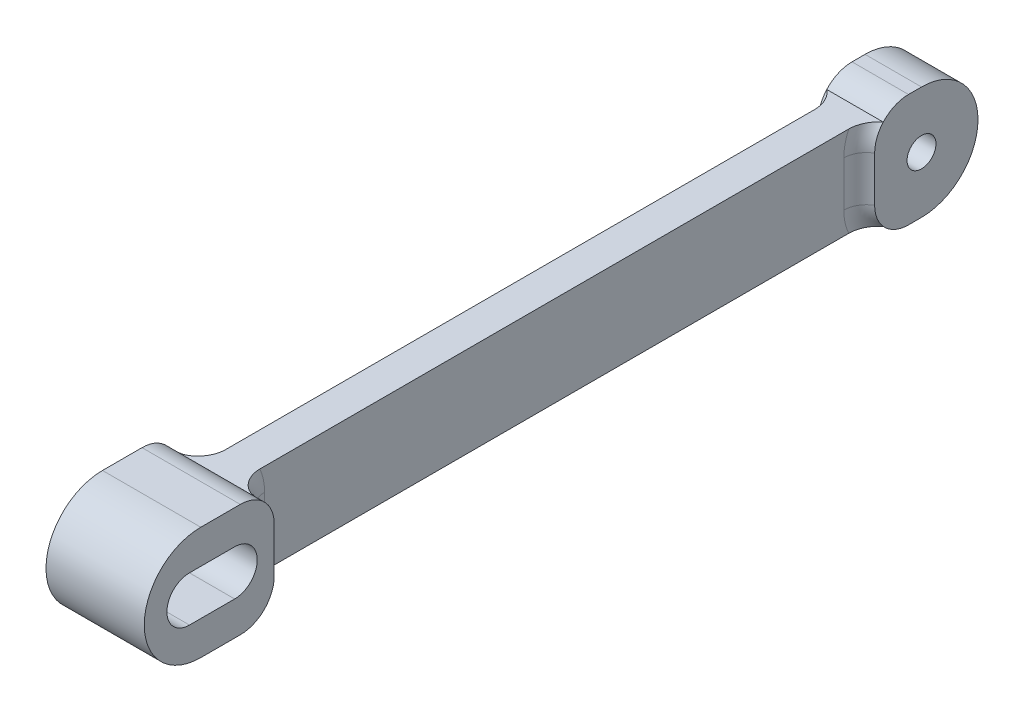
from build123d import *

# Parameters (mm, degrees)
SKETCH1_R           = 2.000000000000003
SKETCH1_R_2         = 1.2800000000000016
BOSS_EXTRUDE1_DEPTH = 2.5
BOSS_EXTRUDE2_START = -2.5
BOSS_EXTRUDE2_DEPTH = 4.35
CUT_EXTRUDE1_DEPTH  = 8.7
SKETCH5_OUTSIDE_W   = 26.059999999999995
SKETCH5_OUTSIDE_H   = 27.360000000000003
CUT_EXTRUDE2_DEPTH  = 55
FILLET1_R           = 3
FILLET2_R           = 2
BOSS_EXTRUDE3_DEPTH = 1


with BuildPart() as part:
    # Sketch1 → Boss-Extrude1 (new, symmetric)
    with BuildSketch(Plane(origin=(0, 0, 0), x_dir=(0, 0, -1), z_dir=(1, 0, 0))):
        with BuildLine():
            Line((-32.325, 5.000000000000013), (32.325, 5.000000000000025))
            ThreePointArc((32.325, 5.000000000000025), (37.32499999999999, 0), (32.325, -4.999999999999987))
            Line((32.325, -4.999999999999987), (-32.325, -4.999999999999987))
            ThreePointArc((-32.325, -4.999999999999987), (-37.32500000000002, 6.1e-16), (-32.325, 5.000000000000013))
        make_face()
        with Locations((-32.325, 0)):
            Circle(SKETCH1_R, mode=Mode.SUBTRACT)
        with Locations((32.325, 0)):
            Circle(SKETCH1_R_2, mode=Mode.SUBTRACT)
    extrude(amount=BOSS_EXTRUDE1_DEPTH, both=True)

    # Sketch3 → Boss-Extrude2 (add, symmetric)
    # profile 1 of 2: a face of its own
    with BuildSketch(Plane(origin=(2.5, 0, 0), x_dir=(0, 0, -1), z_dir=(1, 0, 0)).offset(BOSS_EXTRUDE2_START)):
        with BuildLine():
            Line((-26.825000000000003, -4.999999999999987), (-26.825000000000003, 5.000000000000024))
            Line((-26.825000000000003, 5.000000000000024), (-32.325, 5.000000000000025))
            ThreePointArc((-32.325, 5.000000000000013), (-37.32500000000002, 1.341e-14), (-32.325, -4.999999999999987))
            Line((-32.325, -4.9999999999999885), (-26.825000000000003, -4.999999999999987))
        make_face()
        with BuildLine():
            ThreePointArc((-34.325, -2.000000000000003), (-36.325, -1.32e-15), (-34.325, 2.0000000000000004))
            Line((-34.325, 2.0000000000000013), (-30.325, 2.0000000000000027))
            ThreePointArc((-30.325, 2.0000000000000018), (-28.324999999999992, -3.2e-16), (-30.325, -2.0000000000000027))
            Line((-30.325, -2.0000000000000036), (-34.325, -2.000000000000004))
        make_face(mode=Mode.SUBTRACT)
    # profile 2 of 2: a face of its own
    with BuildSketch(Plane(origin=(2.5, 0, 0), x_dir=(0, 0, -1), z_dir=(1, 0, 0)).offset(BOSS_EXTRUDE2_START)):
        with BuildLine():
            ThreePointArc((-32.325, -4.999999999999987), (-37.32500000000002, 1.341e-14), (-32.325, 5.000000000000013))
            Line((-32.325, 5.000000000000025), (-33.325, 5.000000000000025))
            ThreePointArc((-33.325, 5.000000000000025), (-38.32500000000001, 1.829e-14), (-33.325, -4.999999999999989))
            Line((-33.325, -4.9999999999999885), (-32.325, -4.9999999999999885))
        make_face()
    extrude(amount=BOSS_EXTRUDE2_DEPTH, both=True)

    # Sketch4 → Cut-Extrude1 (cut)
    with BuildSketch(Plane(origin=(4.35, 0, 0), x_dir=(0, 0, -1), z_dir=(1, 0, 0))):
        with BuildLine():
            Line((-30.32500000000482, 2.000000000000003), (-34.32500000000001, 2.0000000000000013))
            ThreePointArc((-34.32500000000001, 2.0000000000000013), (-36.324999999999996, 1.195448e-11), (-34.32500000002392, -2.000000000000004))
            Line((-34.32500000002392, -2.000000000000004), (-30.32500000000482, -2.000000000000003))
            ThreePointArc((-30.32500000000482, -2.000000000000003), (-28.325000000004817, 0), (-30.32500000000482, 2.000000000000003))
        make_face()
    extrude(amount=-CUT_EXTRUDE1_DEPTH, mode=Mode.SUBTRACT)

    # Sketch5 outside → Cut-Extrude2 (cut)
    with BuildSketch(Plane(origin=(0, 0, 26.824999999973898), x_dir=(-1, 0, 0), z_dir=(0, 0, -1))):
        Rectangle(SKETCH5_OUTSIDE_W, SKETCH5_OUTSIDE_H)
        Polygon((1.5, 4.000000000000025), (-1.5, 4.000000000000025), (-1.4999999999999991, -4.000000000000006), (1.500000000000001, -4.000000000000006), align=None, mode=Mode.SUBTRACT)
    extrude(amount=CUT_EXTRUDE2_DEPTH, mode=Mode.SUBTRACT)

    # Fillet1
    # the kernel refuses this fillet: 3 mm, written as the material it takes off along each edge
    with BuildSketch(Plane(origin=(2.5, -4.999999999999987, 26.825000000000003), x_dir=(0, 1.0, -8.701780037275361e-12), z_dir=(-1, 0, 0))) as fillet1_piece_1_section:
        with BuildLine():
            CenterArc((FILLET1_R, -FILLET1_R), FILLET1_R, 89.99999999950143, 90.00000000000003)
            Line((-2.610534e-11, -FILLET1_R), (0, 0))
            Line((0, 0), (FILLET1_R, 0))
        make_face()
    fillet1_piece_1 = extrude(amount=14.349999999999998, mode=Mode.PRIVATE)
    fillet1_piece_1 = split(fillet1_piece_1, bisect_by=Plane(origin=(1.499999999999999, -4.999999999999987, 26.825000000000003), z_dir=(1, -1.1e-16, 0)), keep=Keep.TOP, mode=Mode.PRIVATE)
    fillet1_piece_1 = split(fillet1_piece_1, bisect_by=Plane(origin=(2.5, -4.000000000000006, 26.825000000000003), z_dir=(0, 1, 0)), keep=Keep.TOP, mode=Mode.PRIVATE)
    add(fillet1_piece_1, mode=Mode.SUBTRACT)
    with BuildSketch(Plane(origin=(2.5, -4.999999999999987, 26.825000000000003), x_dir=(0, 1.0, -8.701780037275361e-12), z_dir=(-1, 0, 0))) as fillet1_piece_2_section:
        with BuildLine():
            CenterArc((FILLET1_R, -FILLET1_R), FILLET1_R, 89.99999999950143, 90.00000000000003)
            Line((-2.610534e-11, -FILLET1_R), (0, 0))
            Line((0, 0), (FILLET1_R, 0))
        make_face()
    fillet1_piece_2 = extrude(amount=14.349999999999998, mode=Mode.PRIVATE)
    fillet1_piece_2 = split(fillet1_piece_2, bisect_by=Plane(origin=(1.4999999999999991, -4.999999999999987, 26.825000000000003), z_dir=(1, -1.1e-16, 0)), keep=Keep.TOP, mode=Mode.PRIVATE)
    fillet1_piece_2 = split(fillet1_piece_2, bisect_by=Plane(origin=(2.5, -4.000000000000006, 26.825000000000003), z_dir=(0, -1, 0)), keep=Keep.TOP, mode=Mode.PRIVATE)
    add(fillet1_piece_2, mode=Mode.SUBTRACT)
    with BuildSketch(Plane(origin=(2.5, -4.999999999999987, 26.825000000000003), x_dir=(0, 1.0, -8.701780037275361e-12), z_dir=(-1, 0, 0))) as fillet1_piece_3_section:
        with BuildLine():
            CenterArc((FILLET1_R, -FILLET1_R), FILLET1_R, 89.99999999950143, 90.00000000000003)
            Line((-2.610534e-11, -FILLET1_R), (0, 0))
            Line((0, 0), (FILLET1_R, 0))
        make_face()
    fillet1_piece_3 = extrude(amount=14.349999999999998, mode=Mode.PRIVATE)
    fillet1_piece_3 = split(fillet1_piece_3, bisect_by=Plane(origin=(1.4999999999999991, -4.999999999999987, 26.825000000000003), z_dir=(-1, 1.1e-16, 0)), keep=Keep.TOP, mode=Mode.PRIVATE)
    fillet1_piece_3 = split(fillet1_piece_3, bisect_by=Plane(origin=(-1.5000000000000009, -4.999999999999986, 26.825000000000003), z_dir=(1, -1.4e-16, 0)), keep=Keep.TOP, mode=Mode.PRIVATE)
    fillet1_piece_3 = split(fillet1_piece_3, bisect_by=Plane(origin=(2.5, -4.000000000000006, 26.825000000000003), z_dir=(0, -1, 0)), keep=Keep.TOP, mode=Mode.PRIVATE)
    add(fillet1_piece_3, mode=Mode.SUBTRACT)
    with BuildSketch(Plane(origin=(2.5, -4.999999999999987, 26.825000000000003), x_dir=(0, 1.0, -8.701780037275361e-12), z_dir=(-1, 0, 0))) as fillet1_piece_4_section:
        with BuildLine():
            CenterArc((FILLET1_R, -FILLET1_R), FILLET1_R, 89.99999999950143, 90.00000000000003)
            Line((-2.610534e-11, -FILLET1_R), (0, 0))
            Line((0, 0), (FILLET1_R, 0))
        make_face()
    fillet1_piece_4 = extrude(amount=14.349999999999998, mode=Mode.PRIVATE)
    fillet1_piece_4 = split(fillet1_piece_4, bisect_by=Plane(origin=(-1.5000000000000009, -4.999999999999986, 26.825000000000003), z_dir=(-1, 1.4e-16, 0)), keep=Keep.TOP, mode=Mode.PRIVATE)
    fillet1_piece_4 = split(fillet1_piece_4, bisect_by=Plane(origin=(2.5, -4.000000000000006, 26.825000000000003), z_dir=(0, 1, 0)), keep=Keep.TOP, mode=Mode.PRIVATE)
    add(fillet1_piece_4, mode=Mode.SUBTRACT)
    with BuildSketch(Plane(origin=(2.5, -4.999999999999987, 26.825000000000003), x_dir=(0, 1.0, -8.701780037275361e-12), z_dir=(-1, 0, 0))) as fillet1_piece_5_section:
        with BuildLine():
            CenterArc((FILLET1_R, -FILLET1_R), FILLET1_R, 89.99999999950143, 90.00000000000003)
            Line((-2.610534e-11, -FILLET1_R), (0, 0))
            Line((0, 0), (FILLET1_R, 0))
        make_face()
    fillet1_piece_5 = extrude(amount=14.349999999999998, mode=Mode.PRIVATE)
    fillet1_piece_5 = split(fillet1_piece_5, bisect_by=Plane(origin=(-1.5000000000000009, -4.999999999999986, 26.825000000000003), z_dir=(-1, 1.4e-16, 0)), keep=Keep.TOP, mode=Mode.PRIVATE)
    fillet1_piece_5 = split(fillet1_piece_5, bisect_by=Plane(origin=(2.5, -4.000000000000006, 26.825000000000003), z_dir=(0, -1, 0)), keep=Keep.TOP, mode=Mode.PRIVATE)
    add(fillet1_piece_5, mode=Mode.SUBTRACT)
    with BuildSketch(Plane(origin=(-2.5, 5.000000000000014, 26.824999999973898), x_dir=(0, -1, 0), z_dir=(1, 0, 0))) as fillet1_piece_6_section:
        with BuildLine():
            CenterArc((FILLET1_R, -FILLET1_R), FILLET1_R, 90, 90)
            Line((8.9e-16, -FILLET1_R), (0, 0))
            Line((0, 0), (FILLET1_R, 0))
        make_face()
    fillet1_piece_6 = extrude(amount=5, mode=Mode.PRIVATE)
    fillet1_piece_6 = split(fillet1_piece_6, bisect_by=Plane(origin=(-1.4999999999999998, 5.000000000000014, 26.824999999973898), z_dir=(-1, 1.4e-16, 0)), keep=Keep.TOP, mode=Mode.PRIVATE)
    fillet1_piece_6 = split(fillet1_piece_6, bisect_by=Plane(origin=(-2.5, 4.000000000000025, 26.824999999973898), z_dir=(0, -1, 0)), keep=Keep.TOP, mode=Mode.PRIVATE)
    add(fillet1_piece_6, mode=Mode.SUBTRACT)
    with BuildSketch(Plane(origin=(-2.5, 5.000000000000014, 26.824999999973898), x_dir=(0, -1, 0), z_dir=(1, 0, 0))) as fillet1_piece_7_section:
        with BuildLine():
            CenterArc((FILLET1_R, -FILLET1_R), FILLET1_R, 90, 90)
            Line((8.9e-16, -FILLET1_R), (0, 0))
            Line((0, 0), (FILLET1_R, 0))
        make_face()
    fillet1_piece_7 = extrude(amount=5, mode=Mode.PRIVATE)
    fillet1_piece_7 = split(fillet1_piece_7, bisect_by=Plane(origin=(-1.5, 5.000000000000014, 26.824999999973898), z_dir=(-1, 1.4e-16, 0)), keep=Keep.TOP, mode=Mode.PRIVATE)
    fillet1_piece_7 = split(fillet1_piece_7, bisect_by=Plane(origin=(-2.5, 4.000000000000025, 26.824999999973898), z_dir=(0, 1, 0)), keep=Keep.TOP, mode=Mode.PRIVATE)
    add(fillet1_piece_7, mode=Mode.SUBTRACT)
    with BuildSketch(Plane(origin=(-2.5, 5.000000000000014, 26.824999999973898), x_dir=(0, -1, 0), z_dir=(1, 0, 0))) as fillet1_piece_8_section:
        with BuildLine():
            CenterArc((FILLET1_R, -FILLET1_R), FILLET1_R, 90, 90)
            Line((8.9e-16, -FILLET1_R), (0, 0))
            Line((0, 0), (FILLET1_R, 0))
        make_face()
    fillet1_piece_8 = extrude(amount=5, mode=Mode.PRIVATE)
    fillet1_piece_8 = split(fillet1_piece_8, bisect_by=Plane(origin=(1.5, 5.000000000000014, 26.824999999973898), z_dir=(-1, 1.1e-16, 0)), keep=Keep.TOP, mode=Mode.PRIVATE)
    fillet1_piece_8 = split(fillet1_piece_8, bisect_by=Plane(origin=(-1.5, 5.000000000000014, 26.824999999973898), z_dir=(1, -1.4e-16, 0)), keep=Keep.TOP, mode=Mode.PRIVATE)
    fillet1_piece_8 = split(fillet1_piece_8, bisect_by=Plane(origin=(-2.5, 4.000000000000025, 26.824999999973898), z_dir=(0, 1, 0)), keep=Keep.TOP, mode=Mode.PRIVATE)
    add(fillet1_piece_8, mode=Mode.SUBTRACT)
    with BuildSketch(Plane(origin=(-2.5, 5.000000000000014, 26.824999999973898), x_dir=(0, -1, 0), z_dir=(1, 0, 0))) as fillet1_piece_9_section:
        with BuildLine():
            CenterArc((FILLET1_R, -FILLET1_R), FILLET1_R, 90, 90)
            Line((8.9e-16, -FILLET1_R), (0, 0))
            Line((0, 0), (FILLET1_R, 0))
        make_face()
    fillet1_piece_9 = extrude(amount=5, mode=Mode.PRIVATE)
    fillet1_piece_9 = split(fillet1_piece_9, bisect_by=Plane(origin=(1.5, 5.000000000000014, 26.824999999973898), z_dir=(1, -1.1e-16, 0)), keep=Keep.TOP, mode=Mode.PRIVATE)
    fillet1_piece_9 = split(fillet1_piece_9, bisect_by=Plane(origin=(-2.5, 4.000000000000025, 26.824999999973898), z_dir=(0, -1, 0)), keep=Keep.TOP, mode=Mode.PRIVATE)
    add(fillet1_piece_9, mode=Mode.SUBTRACT)
    with BuildSketch(Plane(origin=(-2.5, 5.000000000000014, 26.824999999973898), x_dir=(0, -1, 0), z_dir=(1, 0, 0))) as fillet1_piece_10_section:
        with BuildLine():
            CenterArc((FILLET1_R, -FILLET1_R), FILLET1_R, 90, 90)
            Line((8.9e-16, -FILLET1_R), (0, 0))
            Line((0, 0), (FILLET1_R, 0))
        make_face()
    fillet1_piece_10 = extrude(amount=5, mode=Mode.PRIVATE)
    fillet1_piece_10 = split(fillet1_piece_10, bisect_by=Plane(origin=(1.5, 5.000000000000014, 26.824999999973898), z_dir=(1, -1.1e-16, 0)), keep=Keep.TOP, mode=Mode.PRIVATE)
    fillet1_piece_10 = split(fillet1_piece_10, bisect_by=Plane(origin=(-2.5, 4.000000000000025, 26.824999999973898), z_dir=(0, 1, 0)), keep=Keep.TOP, mode=Mode.PRIVATE)
    add(fillet1_piece_10, mode=Mode.SUBTRACT)
    with BuildSketch(Plane(origin=(10, -4.999999999999987, -28.175000000026102), x_dir=(0, 0, -1), z_dir=(-1, 0, 0))) as fillet1_piece_11_section:
        with BuildLine():
            CenterArc((FILLET1_R, -FILLET1_R), FILLET1_R, 90, 90)
            Line((0, -FILLET1_R), (0, 0))
            Line((0, 0), (FILLET1_R, 0))
        make_face()
    fillet1_piece_11 = extrude(amount=20, mode=Mode.PRIVATE)
    fillet1_piece_11 = split(fillet1_piece_11, bisect_by=Plane(origin=(10, -4.000000000000006, -28.175000000026102), z_dir=(0, -1, 0)), keep=Keep.TOP, mode=Mode.PRIVATE)
    fillet1_piece_11 = split(fillet1_piece_11, bisect_by=Plane(origin=(1.5, -4.999999999999986, -28.175000000026102), z_dir=(1, -1.1e-16, 0)), keep=Keep.TOP, mode=Mode.PRIVATE)
    add(fillet1_piece_11, mode=Mode.SUBTRACT)
    with BuildSketch(Plane(origin=(10, -4.999999999999987, -28.175000000026102), x_dir=(0, 0, -1), z_dir=(-1, 0, 0))) as fillet1_piece_12_section:
        with BuildLine():
            CenterArc((FILLET1_R, -FILLET1_R), FILLET1_R, 90, 90)
            Line((0, -FILLET1_R), (0, 0))
            Line((0, 0), (FILLET1_R, 0))
        make_face()
    fillet1_piece_12 = extrude(amount=20, mode=Mode.PRIVATE)
    fillet1_piece_12 = split(fillet1_piece_12, bisect_by=Plane(origin=(10, -4.000000000000006, -28.175000000026102), z_dir=(0, 1, 0)), keep=Keep.TOP, mode=Mode.PRIVATE)
    fillet1_piece_12 = split(fillet1_piece_12, bisect_by=Plane(origin=(1.5, -4.999999999999986, -28.175000000026102), z_dir=(1, -1.1e-16, 0)), keep=Keep.TOP, mode=Mode.PRIVATE)
    add(fillet1_piece_12, mode=Mode.SUBTRACT)
    with BuildSketch(Plane(origin=(10, -4.999999999999987, -28.175000000026102), x_dir=(0, 0, -1), z_dir=(-1, 0, 0))) as fillet1_piece_13_section:
        with BuildLine():
            CenterArc((FILLET1_R, -FILLET1_R), FILLET1_R, 90, 90)
            Line((0, -FILLET1_R), (0, 0))
            Line((0, 0), (FILLET1_R, 0))
        make_face()
    fillet1_piece_13 = extrude(amount=20, mode=Mode.PRIVATE)
    fillet1_piece_13 = split(fillet1_piece_13, bisect_by=Plane(origin=(-1.5000000000000018, -4.999999999999985, -28.175000000026102), z_dir=(1, -1.4e-16, 0)), keep=Keep.TOP, mode=Mode.PRIVATE)
    fillet1_piece_13 = split(fillet1_piece_13, bisect_by=Plane(origin=(10, -4.000000000000006, -28.175000000026102), z_dir=(0, -1, 0)), keep=Keep.TOP, mode=Mode.PRIVATE)
    fillet1_piece_13 = split(fillet1_piece_13, bisect_by=Plane(origin=(1.5, -4.999999999999986, -28.175000000026102), z_dir=(-1, 1.1e-16, 0)), keep=Keep.TOP, mode=Mode.PRIVATE)
    add(fillet1_piece_13, mode=Mode.SUBTRACT)
    with BuildSketch(Plane(origin=(10, -4.999999999999987, -28.175000000026102), x_dir=(0, 0, -1), z_dir=(-1, 0, 0))) as fillet1_piece_14_section:
        with BuildLine():
            CenterArc((FILLET1_R, -FILLET1_R), FILLET1_R, 90, 90)
            Line((0, -FILLET1_R), (0, 0))
            Line((0, 0), (FILLET1_R, 0))
        make_face()
    fillet1_piece_14 = extrude(amount=20, mode=Mode.PRIVATE)
    fillet1_piece_14 = split(fillet1_piece_14, bisect_by=Plane(origin=(-1.5000000000000018, -4.999999999999985, -28.175000000026102), z_dir=(-1, 1.4e-16, 0)), keep=Keep.TOP, mode=Mode.PRIVATE)
    fillet1_piece_14 = split(fillet1_piece_14, bisect_by=Plane(origin=(10, -4.000000000000006, -28.175000000026102), z_dir=(0, -1, 0)), keep=Keep.TOP, mode=Mode.PRIVATE)
    add(fillet1_piece_14, mode=Mode.SUBTRACT)
    with BuildSketch(Plane(origin=(10, -4.999999999999987, -28.175000000026102), x_dir=(0, 0, -1), z_dir=(-1, 0, 0))) as fillet1_piece_15_section:
        with BuildLine():
            CenterArc((FILLET1_R, -FILLET1_R), FILLET1_R, 90, 90)
            Line((0, -FILLET1_R), (0, 0))
            Line((0, 0), (FILLET1_R, 0))
        make_face()
    fillet1_piece_15 = extrude(amount=20, mode=Mode.PRIVATE)
    fillet1_piece_15 = split(fillet1_piece_15, bisect_by=Plane(origin=(-1.5000000000000018, -4.999999999999985, -28.175000000026102), z_dir=(-1, 1.4e-16, 0)), keep=Keep.TOP, mode=Mode.PRIVATE)
    fillet1_piece_15 = split(fillet1_piece_15, bisect_by=Plane(origin=(10, -4.000000000000006, -28.175000000026102), z_dir=(0, 1, 0)), keep=Keep.TOP, mode=Mode.PRIVATE)
    add(fillet1_piece_15, mode=Mode.SUBTRACT)
    with BuildSketch(Plane(origin=(-10, 5.000000000000024, -28.175000000026102), x_dir=(0, 3e-16, -1), z_dir=(1, 0, 0))) as fillet1_piece_16_section:
        with BuildLine():
            CenterArc((FILLET1_R, -FILLET1_R), FILLET1_R, 89.99999999999999, 90.00000000000001)
            Line((-8.9e-16, -FILLET1_R), (0, 0))
            Line((0, 0), (FILLET1_R, 0))
        make_face()
    fillet1_piece_16 = extrude(amount=20, mode=Mode.PRIVATE)
    fillet1_piece_16 = split(fillet1_piece_16, bisect_by=Plane(origin=(-1.5, 5.000000000000023, -28.175000000026102), z_dir=(-1, 1.4e-16, 0)), keep=Keep.TOP, mode=Mode.PRIVATE)
    fillet1_piece_16 = split(fillet1_piece_16, bisect_by=Plane(origin=(-10, 4.000000000000025, -28.175000000026102), z_dir=(0, 1, 0)), keep=Keep.TOP, mode=Mode.PRIVATE)
    add(fillet1_piece_16, mode=Mode.SUBTRACT)
    with BuildSketch(Plane(origin=(-10, 5.000000000000024, -28.175000000026102), x_dir=(0, 3e-16, -1), z_dir=(1, 0, 0))) as fillet1_piece_17_section:
        with BuildLine():
            CenterArc((FILLET1_R, -FILLET1_R), FILLET1_R, 89.99999999999999, 90.00000000000001)
            Line((-8.9e-16, -FILLET1_R), (0, 0))
            Line((0, 0), (FILLET1_R, 0))
        make_face()
    fillet1_piece_17 = extrude(amount=20, mode=Mode.PRIVATE)
    fillet1_piece_17 = split(fillet1_piece_17, bisect_by=Plane(origin=(-1.5, 5.000000000000023, -28.175000000026102), z_dir=(-1, 1.4e-16, 0)), keep=Keep.TOP, mode=Mode.PRIVATE)
    fillet1_piece_17 = split(fillet1_piece_17, bisect_by=Plane(origin=(-10, 4.000000000000025, -28.175000000026102), z_dir=(0, -1, 0)), keep=Keep.TOP, mode=Mode.PRIVATE)
    add(fillet1_piece_17, mode=Mode.SUBTRACT)
    with BuildSketch(Plane(origin=(-10, 5.000000000000024, -28.175000000026102), x_dir=(0, 3e-16, -1), z_dir=(1, 0, 0))) as fillet1_piece_18_section:
        with BuildLine():
            CenterArc((FILLET1_R, -FILLET1_R), FILLET1_R, 89.99999999999999, 90.00000000000001)
            Line((-8.9e-16, -FILLET1_R), (0, 0))
            Line((0, 0), (FILLET1_R, 0))
        make_face()
    fillet1_piece_18 = extrude(amount=20, mode=Mode.PRIVATE)
    fillet1_piece_18 = split(fillet1_piece_18, bisect_by=Plane(origin=(-1.5, 5.000000000000023, -28.175000000026102), z_dir=(1, -1.4e-16, 0)), keep=Keep.TOP, mode=Mode.PRIVATE)
    fillet1_piece_18 = split(fillet1_piece_18, bisect_by=Plane(origin=(-10, 4.000000000000025, -28.175000000026102), z_dir=(0, 1, 0)), keep=Keep.TOP, mode=Mode.PRIVATE)
    fillet1_piece_18 = split(fillet1_piece_18, bisect_by=Plane(origin=(1.5, 5.000000000000023, -28.175000000026102), z_dir=(-1, 1.1e-16, 0)), keep=Keep.TOP, mode=Mode.PRIVATE)
    add(fillet1_piece_18, mode=Mode.SUBTRACT)
    with BuildSketch(Plane(origin=(-10, 5.000000000000024, -28.175000000026102), x_dir=(0, 3e-16, -1), z_dir=(1, 0, 0))) as fillet1_piece_19_section:
        with BuildLine():
            CenterArc((FILLET1_R, -FILLET1_R), FILLET1_R, 89.99999999999999, 90.00000000000001)
            Line((-8.9e-16, -FILLET1_R), (0, 0))
            Line((0, 0), (FILLET1_R, 0))
        make_face()
    fillet1_piece_19 = extrude(amount=20, mode=Mode.PRIVATE)
    fillet1_piece_19 = split(fillet1_piece_19, bisect_by=Plane(origin=(-10, 4.000000000000025, -28.175000000026102), z_dir=(0, 1, 0)), keep=Keep.TOP, mode=Mode.PRIVATE)
    fillet1_piece_19 = split(fillet1_piece_19, bisect_by=Plane(origin=(1.5, 5.000000000000023, -28.175000000026102), z_dir=(1, -1.1e-16, 0)), keep=Keep.TOP, mode=Mode.PRIVATE)
    add(fillet1_piece_19, mode=Mode.SUBTRACT)
    with BuildSketch(Plane(origin=(-10, 5.000000000000024, -28.175000000026102), x_dir=(0, 3e-16, -1), z_dir=(1, 0, 0))) as fillet1_piece_20_section:
        with BuildLine():
            CenterArc((FILLET1_R, -FILLET1_R), FILLET1_R, 89.99999999999999, 90.00000000000001)
            Line((-8.9e-16, -FILLET1_R), (0, 0))
            Line((0, 0), (FILLET1_R, 0))
        make_face()
    fillet1_piece_20 = extrude(amount=20, mode=Mode.PRIVATE)
    fillet1_piece_20 = split(fillet1_piece_20, bisect_by=Plane(origin=(-10, 4.000000000000025, -28.175000000026102), z_dir=(0, -1, 0)), keep=Keep.TOP, mode=Mode.PRIVATE)
    fillet1_piece_20 = split(fillet1_piece_20, bisect_by=Plane(origin=(1.5, 5.000000000000023, -28.175000000026102), z_dir=(1, -1.1e-16, 0)), keep=Keep.TOP, mode=Mode.PRIVATE)
    add(fillet1_piece_20, mode=Mode.SUBTRACT)
    with BuildSketch(Plane(origin=(-2.5, 5.000000000000024, 26.825000000000003), x_dir=(0, -1.0, -8.701780037275332e-12), z_dir=(-1, 0, 0))) as fillet1_piece_21:
        with BuildLine():
            CenterArc((FILLET1_R, FILLET1_R), FILLET1_R, 180.00000000049855, 90)
            Line((-2.609557e-11, FILLET1_R), (0, 0))
            Line((0, 0), (FILLET1_R, 0))
        make_face()
    extrude(amount=9.350000000000025, mode=Mode.SUBTRACT)
    with BuildSketch(Plane(origin=(11.850000000000026, 5.000000000000024, 26.825000000000003), x_dir=(0, -1.0, -8.701780037275332e-12), z_dir=(-1, 0, 0))) as fillet1_piece_22:
        with BuildLine():
            CenterArc((FILLET1_R, FILLET1_R), FILLET1_R, 180.00000000049855, 90)
            Line((-2.609557e-11, FILLET1_R), (0, 0))
            Line((0, 0), (FILLET1_R, 0))
        make_face()
    extrude(amount=9.350000000000026, mode=Mode.SUBTRACT)
    with BuildSketch(Plane(origin=(2.5, -4.999999999999987, 26.825000000000003), x_dir=(0, 1.0, -8.701780037275361e-12), z_dir=(1, 0, 0))) as fillet1_piece_23:
        with BuildLine():
            CenterArc((FILLET1_R, FILLET1_R), FILLET1_R, 180.00000000049855, 90)
            Line((-2.610534e-11, FILLET1_R), (0, 0))
            Line((0, 0), (FILLET1_R, 0))
        make_face()
    extrude(amount=9.35, mode=Mode.SUBTRACT)

    # Fillet2
    # the kernel refuses this fillet: 2 mm, written as the material it adds along each edge
    with BuildSketch(Plane(origin=(-1.5, 2, -31.175000000026), x_dir=(0, 0, 1), z_dir=(0, -1, 0))) as fillet2_piece_1_section:
        with BuildLine():
            CenterArc((4.7320508075689744, 2), FILLET2_R, 209.99999999999858, 60.00000000000142)
            Line((4.7320508075689744, 0), (3, 0))
            Line((3, 0), (3.000000000000071, 1.0000000000000417))
        make_face()
    fillet2_piece_1 = revolve(axis=Axis((-1.5, 2, -31.175000000026), (-1, 0, 0)), revolution_arc=124.5168172217792, mode=Mode.PRIVATE)
    fillet2_piece_1 = split(fillet2_piece_1, bisect_by=Plane(origin=(-1.5, 4, -31.175000000026), z_dir=(0, -1, 0)), keep=Keep.TOP, mode=Mode.PRIVATE)
    add(fillet2_piece_1)
    with BuildSketch(Plane(origin=(-1.5, -2, -31.175000000026), x_dir=(0, 1.5e-16, 1), z_dir=(0, 1, -1.5e-16))) as fillet2_piece_2_section:
        with BuildLine():
            CenterArc((4.7320508075689744, -2.000000000000001), FILLET2_R, 90, 60.00000000000142)
            Line((3.000000000000071, -1.0000000000000422), (3, 0))
            Line((3, 0), (4.7320508075689744, -8.9e-16))
        make_face()
    fillet2_piece_2 = revolve(axis=Axis((-1.5, -2, -31.175000000026), (1, 0, 0)), revolution_arc=124.51681722177923, mode=Mode.PRIVATE)
    fillet2_piece_2 = split(fillet2_piece_2, bisect_by=Plane(origin=(-1.5, -4, -31.175000000026), z_dir=(0, 1, 0)), keep=Keep.TOP, mode=Mode.PRIVATE)
    add(fillet2_piece_2)
    with BuildSketch(Plane(origin=(1.5, 2, -31.175000000026), x_dir=(0, -1.5e-16, 1), z_dir=(0, -1, -1.5e-16))) as fillet2_piece_3_section:
        with BuildLine():
            CenterArc((4.7320508075689744, -2), FILLET2_R, 90, 60.00000000000142)
            Line((4.7320508075689744, 0), (3, 0))
            Line((3, 0), (3.000000000000071, -1.0000000000000417))
        make_face()
    fillet2_piece_3 = revolve(axis=Axis((1.5, 2, -31.175000000026), (-1, 0, 0)), revolution_arc=124.51681722177923, mode=Mode.PRIVATE)
    fillet2_piece_3 = split(fillet2_piece_3, bisect_by=Plane(origin=(1.5, 4, -31.175000000026), z_dir=(0, -1, 0)), keep=Keep.TOP, mode=Mode.PRIVATE)
    add(fillet2_piece_3)
    with BuildSketch(Plane(origin=(1.5, -2, -31.175000000026), x_dir=(0, 0, 1), z_dir=(0, 1, 0))) as fillet2_piece_4_section:
        with BuildLine():
            CenterArc((4.7320508075689744, 2), FILLET2_R, 209.99999999999858, 60.00000000000142)
            Line((3.000000000000071, 1.0000000000000417), (3, 0))
            Line((3, 0), (4.7320508075689744, 0))
        make_face()
    fillet2_piece_4 = revolve(axis=Axis((1.5, -2, -31.175000000026), (1, 0, 0)), revolution_arc=124.5168172217792, mode=Mode.PRIVATE)
    fillet2_piece_4 = split(fillet2_piece_4, bisect_by=Plane(origin=(1.5, -4, -31.175000000026), z_dir=(0, 1, 0)), keep=Keep.TOP, mode=Mode.PRIVATE)
    add(fillet2_piece_4)
    with BuildSketch(Plane(origin=(1.5, 2, 29.824999999974), x_dir=(0, 0.6780114096841094, 0.7350513780261668), z_dir=(0, -0.7350513780261668, 0.6780114096841094))) as fillet2_piece_5_section:
        with BuildLine():
            CenterArc((3.0000000000000027 + FILLET2_R, -FILLET2_R), FILLET2_R, 90.00000000000007, 89.99999999999994)
            Line((3.0000000000000027 + FILLET2_R, 0), (3.0000000000000027, 0))
            Line((3.0000000000000027, 0), (3.0000000000000027, -FILLET2_R))
        make_face()
    fillet2_piece_5 = revolve(axis=Axis((1.5, 2, 29.824999999974), (-1, 0, 0)), revolution_arc=137.31155765907098, mode=Mode.PRIVATE)
    fillet2_piece_5 = split(fillet2_piece_5, bisect_by=Plane(origin=(1.5, 4, 29.824999999974), z_dir=(0, -1, 0)), keep=Keep.TOP, mode=Mode.PRIVATE)
    add(fillet2_piece_5)
    with BuildSketch(Plane(origin=(1.5, -1.9999999999729998, 29.824999999973), x_dir=(0, -4.645321164768272e-12, -1.0), z_dir=(0, 1.0, -4.645321164768272e-12))) as fillet2_piece_6_section:
        with BuildLine():
            CenterArc((3 + FILLET2_R, -FILLET2_R), FILLET2_R, 90.0000000000002, 89.99999999999977)
            Line((3 + FILLET2_R, 0), (3, 0))
            Line((3, 0), (3, -FILLET2_R))
        make_face()
    fillet2_piece_6 = revolve(axis=Axis((1.5, -1.9999999999729998, 29.824999999973), (-1, 0, 0)), revolution_arc=137.31155765949686, mode=Mode.PRIVATE)
    fillet2_piece_6 = split(fillet2_piece_6, bisect_by=Plane(origin=(1.5, -4, 29.824999999973), z_dir=(0, 1, 0)), keep=Keep.TOP, mode=Mode.PRIVATE)
    add(fillet2_piece_6)
    with BuildSketch(Plane(origin=(-1.5, -1.9999999999729998, 29.824999999973), x_dir=(0, -0.6780114096752294, 0.7350513780343578), z_dir=(0, 0.7350513780343578, 0.6780114096752294))) as fillet2_piece_7_section:
        with BuildLine():
            CenterArc((2.9999999999999987 + FILLET2_R, -FILLET2_R), FILLET2_R, 90, 89.99999999999997)
            Line((3.000000000000004, -FILLET2_R), (2.9999999999999987, 0))
            Line((2.9999999999999987, 0), (2.9999999999999987 + FILLET2_R, -8.9e-16))
        make_face()
    fillet2_piece_7 = revolve(axis=Axis((-1.5, -1.9999999999729998, 29.824999999973), (1, 0, 0)), revolution_arc=137.31155765974663, mode=Mode.PRIVATE)
    fillet2_piece_7 = split(fillet2_piece_7, bisect_by=Plane(origin=(-1.5, -4, 29.824999999973), z_dir=(0, 1, 0)), keep=Keep.TOP, mode=Mode.PRIVATE)
    add(fillet2_piece_7)
    with BuildSketch(Plane(origin=(-1.5000000000000009, -2, -28.175000000026102), x_dir=(-1, 1.4e-16, 7.461e-14), z_dir=(1.4e-16, 1, 0))) as fillet2_piece_8:
        with BuildLine():
            CenterArc((2.0000000000001292, 1.7320508075688252), FILLET2_R, 179.99999999999574, 60.000000000001364)
            Line((1.2945e-13, 1.7320508075689744), (0, 0))
            Line((0, 0), (1.0000000000000417, 0))
        make_face()
    extrude(amount=4)
    with BuildSketch(Plane(origin=(1.4999999999999998, 2, -28.175000000026102), x_dir=(2.6e-16, 0, 1), z_dir=(-1.1e-16, -1, 0))) as fillet2_piece_9:
        with BuildLine():
            CenterArc((1.732050807568975, -1.9999999999999996), FILLET2_R, 90.00000000000001, 60.00000000000141)
            Line((7.131e-14, -1.000000000000042), (0, 0))
            Line((0, 0), (1.7320508075689744, 0))
        make_face()
    extrude(amount=4)
    with BuildSketch(Plane(origin=(1.4999999999999998, 2, 26.824999999973898), x_dir=(1, -1.1e-16, 0), z_dir=(-1.1e-16, -1, 0))) as fillet2_piece_10:
        with BuildLine():
            CenterArc((FILLET2_R, -FILLET2_R), FILLET2_R, 90, 89.99999999999989)
            Line((-4.4e-16, -FILLET2_R), (0, 0))
            Line((0, 0), (FILLET2_R, 0))
        make_face()
    extrude(amount=3.999999999986936)
    with BuildSketch(Plane(origin=(-1.5, 2, 29.824999999974), x_dir=(0, 0, -1), z_dir=(0, -1, 0))) as fillet2_piece_11_section:
        with BuildLine():
            CenterArc((3 + FILLET2_R, -FILLET2_R), FILLET2_R, 90, 90)
            Line((3, -FILLET2_R), (3, 0))
            Line((3, 0), (3 + FILLET2_R, 0))
        make_face()
    fillet2_piece_11 = revolve(axis=Axis((-1.5, 2, 29.824999999974), (1, 0, 0)), revolution_arc=137.311557659071, mode=Mode.PRIVATE)
    fillet2_piece_11 = split(fillet2_piece_11, bisect_by=Plane(origin=(-1.5, 4, 29.824999999974), z_dir=(0, -1, 0)), keep=Keep.TOP, mode=Mode.PRIVATE)
    add(fillet2_piece_11)
    with BuildSketch(Plane(origin=(-1.5000000000000009, -1.9999999999869358, 26.824999999973898), x_dir=(0, 0, -1), z_dir=(1.4e-16, 1, 0))) as fillet2_piece_12:
        with BuildLine():
            CenterArc((FILLET2_R, FILLET2_R), FILLET2_R, 180, 90)
            Line((0, FILLET2_R), (0, 0))
            Line((0, 0), (FILLET2_R, 0))
        make_face()
    extrude(amount=3.999999999986936)

    # Sketch7 → Boss-Extrude3 (add)
    # profile 1 of 2: a face of its own
    with BuildSketch(Plane.ZY.offset(1.5000000000000007)):
        Polygon((19.95724742052831, 1.4136959165428955), (20.53782033719498, 1.4136959165428955), (20.53782033719498, -1.726304083457104), (20.256025465400104, -1.726304083457104), (20.256025465400104, 1.0916446344916138), (19.77294854232318, 1.0916446344916138), align=None)
    # profile 2 of 2: a face of its own
    with BuildSketch(Plane.ZY.offset(1.5000000000000007)):
        with BuildLine():
            Line((23.154487003861647, 1.494208737055716), (23.37149421540011, 1.323747999876229))
            Line((23.37149421540011, 1.323747999876229), (22.5418347602719, 0.05504207038904978))
            add(Edge.make_bspline(
                [(22.5418347602719, 0.05504207038904978), (22.597072094479802, 0.06384650537541713), (22.704818760330195, 0.08102055130071681), (22.813880737863503, 0.08385367950301878), (22.867031074374463, 0.08523437808135746)],
                knots=[0, 0, 0, 0, 1.025318672683558, 2, 2, 2, 2], degree=3))
            add(Edge.make_bspline(
                [(22.867031074374463, 0.08523437808135746), (22.8989446853723, 0.08437660930286359), (22.961765678924202, 0.08268811698820656), (23.053998067160304, 0.06969403379609583), (23.14262585543338, 0.049216647670336), (23.227281701856803, 0.01936668090537289), (23.308269462725107, -0.01876400272250854), (23.386053898091046, -0.0644634463455761), (23.459172844300625, -0.12009139957992193), (23.528567902222154, -0.18223195991173327), (23.591571641026114, -0.2510580545730954), (23.647352445154866, -0.32408668236080945), (23.69420733831062, -0.40124175845632837), (23.732222799416267, -0.4824842038936581), (23.76174317621551, -0.567688785327971), (23.78326352062606, -0.656746487611851), (23.795984641041578, -0.7497187220075023), (23.79771208128312, -0.81294771353202), (23.79858956796421, -0.8450661026878733)],
                knots=[0, 0, 0, 0, 1.0436928598724897, 2.0544783360515737, 3.0410731455436575, 4.015093852292497, 4.9847333256342905, 5.965804834509254, 6.960378781699833, 7.985147595312688, 9.009457200794586, 10.008161701285992, 10.986880574874398, 11.956520048216198, 12.937015923455341, 13.931873656255775, 14.949455224094597, 16, 16, 16, 16], degree=3))
            add(Edge.make_bspline(
                [(23.79858956796421, -0.8450661026878733), (23.797312839582375, -0.889007894228737), (23.7948005402743, -0.9754749408258079), (23.769766848987178, -1.1014129002858388), (23.73086705340669, -1.221390071364078), (23.675264356496438, -1.3334909165345683), (23.60620016147674, -1.4375617932417761), (23.521978549769077, -1.5297750393629634), (23.425586391663643, -1.6120161585563542), (23.31659537843931, -1.6807880969314684), (23.19930026206064, -1.7369519769826196), (23.07607589866606, -1.7772922227369714), (22.948118973093187, -1.8021282495619777), (22.861271410438526, -1.8052418759548998), (22.817339567964208, -1.8068169039699244)],
                knots=[0, 0, 0, 0, 1.0313753177295377, 2.0295025425682924, 3.0047892862325973, 3.987476833666035, 4.96037145499058, 5.9300674004542655, 6.912260824639658, 7.929083631048079, 8.94939751096492, 9.9605231157027, 10.96833054984819, 12, 12, 12, 12], degree=3))
            add(Edge.make_bspline(
                [(22.817339567964208, -1.8068169039699244), (22.77508709937873, -1.8054458851026987), (22.69139235693773, -1.8027301367732946), (22.56827493582179, -1.7785378382231374), (22.44997497169267, -1.7393263231677614), (22.337321298535272, -1.68530551327499), (22.232965091508515, -1.617070726854804), (22.139603349109006, -1.5349262821478675), (22.057701585647884, -1.4406280763400277), (21.989541497155752, -1.334190736216095), (21.935480806208815, -1.2198140314835655), (21.894938987675914, -1.1005504111797948), (21.871257786602133, -0.9768344275743461), (21.867948624174954, -0.8929684912756098), (21.866281875656515, -0.8507271603801809)],
                knots=[0, 0, 0, 0, 1.01201666391153, 2.004627820992885, 2.994792926891606, 3.9928857816221575, 4.9909786363527235, 5.973936114479959, 6.964471063296613, 7.975201452678041, 8.993600317351413, 9.990122807281685, 10.98767138001809, 12, 12, 12, 12], degree=3))
            add(Edge.make_bspline(
                [(21.866281875656515, -0.8507271603801809), (21.867341800605256, -0.818390020014757), (21.869505964834307, -0.7523637579368553), (21.884616892166417, -0.6523646014389478), (21.908897879486304, -0.5500444881185055), (21.93609050049964, -0.46324215443505357), (21.964822047797234, -0.39213324616273354), (21.988733183312963, -0.33480268600270113), (22.018494996903584, -0.27580560887212807), (22.05022997317569, -0.21311897544974948), (22.08679470700178, -0.14835833012347258), (22.126552175310174, -0.08044132380670496), (22.170601576408284, -0.01044809727570547), (22.201481379557595, 0.037050409317209), (22.21726745257959, 0.06133213449161391)],
                knots=[0, 0, 0, 0, 1.1738182753765736, 2.3967126408219235, 3.663316289735298, 4.989737886459515, 5.693666773722723, 6.447286557313181, 7.243889046715885, 8.091586357081514, 8.998013823794768, 9.943181721085223, 10.948533337893378, 12, 12, 12, 12], degree=3))
            Line((22.21726745257959, 0.06133213449161391), (23.154487003861647, 1.494208737055716))
        make_face()
        with BuildLine():
            add(Edge.make_bspline(
                [(22.80790447181036, -0.23681690396992466), (22.783984629304104, -0.23751492030230653), (22.737262228294995, -0.23887834896969518), (22.66871386194512, -0.24679586069667508), (22.603838544932007, -0.26170553667486796), (22.541776773599704, -0.2806947602070019), (22.483688834421056, -0.3068043623518946), (22.42915256095716, -0.33851997627164887), (22.377957057263455, -0.37586011895185045), (22.33063855656931, -0.4182957934847483), (22.287737487163515, -0.4647570573646513), (22.250792129845195, -0.5145211429739707), (22.2189234623333, -0.566388742331781), (22.193012344821387, -0.6207932276169703), (22.172835533991552, -0.6777138015344076), (22.158240588925363, -0.7368886709798044), (22.150118080687037, -0.7987146484758993), (22.148766775850746, -0.8406403794960691), (22.148076747451388, -0.8620492757647964)],
                knots=[0, 0, 0, 0, 1.1295886309374765, 2.2064147360579422, 3.2511391649557178, 4.268635594404178, 5.265702195542757, 6.250456723757774, 7.242448910951685, 8.251968644805974, 9.246821452807275, 10.222880185895155, 11.173611482269148, 12.116736599108355, 13.062300277602443, 14.020270553826057, 14.98907374249735, 16, 16, 16, 16], degree=3))
            add(Edge.make_bspline(
                [(22.148076747451388, -0.8620492757647964), (22.1486386831795, -0.8832666862884058), (22.1497405554862, -0.9248708696609335), (22.159745779596893, -0.9861808764746146), (22.175028682024415, -1.0451813942986183), (22.197762637168136, -1.1015682572077172), (22.224880473978907, -1.1562009539567537), (22.260681250537086, -1.2071006100657498), (22.30035002411199, -1.2573586158065722), (22.347767552976602, -1.3031142216008553), (22.398656512906022, -1.345689593004299), (22.453024448868447, -1.3829033061602096), (22.509687955711613, -1.4147394731517342), (22.569412031516148, -1.439690000728538), (22.631349324561445, -1.460166646642837), (22.696015878762726, -1.4745760880344203), (22.763456669153364, -1.4827226170707006), (22.809140922121408, -1.4840756821925492), (22.832435721810363, -1.4847656219186425)],
                knots=[0, 0, 0, 0, 0.9894672477425434, 1.9401979695111415, 2.8919351818450694, 3.8276944291536767, 4.772920940615433, 5.730924761853576, 6.725747692481076, 7.756678648226965, 8.799015740266984, 9.819492440646847, 10.826891315994134, 11.826466727173084, 12.835195251845635, 13.867842841860773, 14.91279443840393, 16, 16, 16, 16], degree=3))
            add(Edge.make_bspline(
                [(22.832435721810363, -1.4847656219186425), (22.85573048333626, -1.4840756280967808), (22.901414661461395, -1.4827224568858146), (22.968855994353845, -1.4745766968407152), (23.033520543071955, -1.4601644126957773), (23.095465125068458, -1.4396980988005714), (23.15516229465328, -1.4147094319129192), (23.21177624480817, -1.3831013667754157), (23.265630020160252, -1.345460735421325), (23.31655238661124, -1.3031869798134996), (23.363772548435477, -1.2570981926333769), (23.404392735766432, -1.2075492416561477), (23.439097122159893, -1.1557895755625918), (23.467298078557935, -1.101783468640536), (23.489781637054225, -1.045147299733321), (23.505142039048373, -0.986190010274628), (23.515126601111742, -0.9248684784090209), (23.516231312539055, -0.8832658786652566), (23.516794696169338, -0.8620492757647964)],
                knots=[0, 0, 0, 0, 1.0873979439112478, 2.132534445880342, 3.16536476411285, 4.174271784495754, 5.174024071730805, 6.181601207505371, 7.194203696827388, 8.236725231653708, 9.267838611856458, 10.269026844132611, 11.221737036576926, 12.171628255771509, 13.107553086790205, 14.059458710154074, 15.010357664852926, 16, 16, 16, 16], degree=3))
            add(Edge.make_bspline(
                [(23.516794696169338, -0.8620492757647964), (23.516301004739542, -0.8406124500847405), (23.515332049020014, -0.7985389329085588), (23.504372598006793, -0.7369163268339457), (23.489172868315084, -0.6774131418236774), (23.46622123504978, -0.6204033475481069), (23.436403306339816, -0.5661119156807969), (23.40008390688939, -0.5142645937157136), (23.358068400953726, -0.4644638821349896), (23.309535179718665, -0.41820467690704954), (23.256702226974042, -0.3759070127005555), (23.20052710181092, -0.3385683249606032), (23.14175709112145, -0.3070562030335083), (23.08045178275809, -0.2807635455714018), (23.01590873946655, -0.2617894459219276), (22.94916997802552, -0.2468491078549177), (22.87938191462482, -0.2388986119523177), (22.832033757450223, -0.23751964492634547), (22.80790447181036, -0.23681690396992466)],
                knots=[0, 0, 0, 0, 0.9782066386499348, 1.919901501619431, 2.851605144121877, 3.780102724190371, 4.718870031278557, 5.6754519809560495, 6.667674622786631, 7.690630535533264, 8.73330832337385, 9.75612968681864, 10.767539655587532, 11.776269906682593, 12.797430371072512, 13.836405706649062, 14.897401972361104, 16, 16, 16, 16], degree=3))
        make_face(mode=Mode.SUBTRACT)
    extrude(amount=BOSS_EXTRUDE3_DEPTH)


solid = part.part
